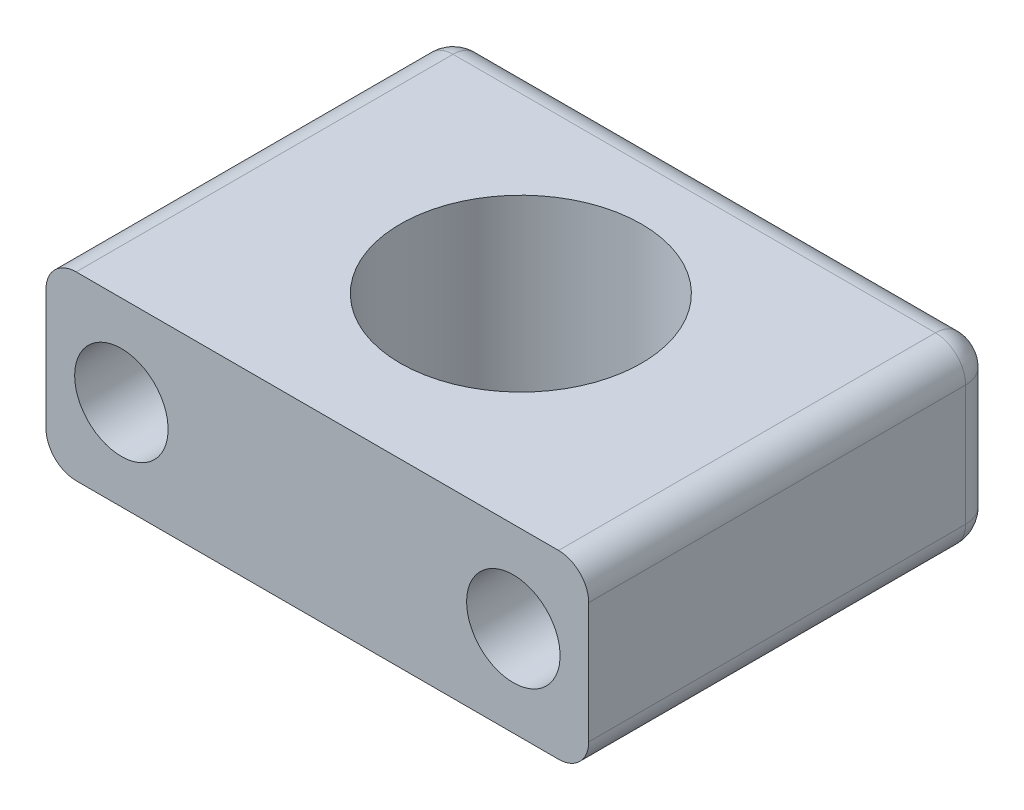
from build123d import *

# Parameters (mm, degrees)
SKETCH1_W           = 36
SKETCH1_H           = 27
SKETCH1_R           = 8
BOSS_EXTRUDE1_DEPTH = 12
SKETCH3_R           = 3.1
CUT_EXTRUDE1_DEPTH  = 35.597687784
FILLET1_R           = 2


with BuildPart() as part:
    # Sketch1 → Boss-Extrude1 (new body)
    with BuildSketch(Plane(origin=(0, 0, 0), x_dir=(1, 0, 0), z_dir=(0, 1, 0))):
        with Locations((0, 13.5)):
            Rectangle(SKETCH1_W, SKETCH1_H)
        with Locations(Location((0, 13.5, 0), (0, 0, 270))):
            Circle(SKETCH1_R, mode=Mode.SUBTRACT)
    extrude(amount=BOSS_EXTRUDE1_DEPTH)

    # Sketch3 → Cut-Extrude1 (cut, through all)
    with BuildSketch(Plane(origin=(0, 0, -27), x_dir=(-1, 0, 0), z_dir=(0, 0, -1))):
        with Locations((13, 6)):
            Circle(SKETCH3_R)
        with Locations((-13, 6)):
            Circle(SKETCH3_R)
    extrude(amount=-CUT_EXTRUDE1_DEPTH, mode=Mode.SUBTRACT)

    # Fillet1
    # the kernel refuses this fillet: 2 mm, written as the material it takes off along each edge
    with BuildSketch(Plane(origin=(16, 10, -25), x_dir=(1, 0, 0), z_dir=(0, 1, 0))) as fillet1_piece_1_section:
        Polygon((0, 0), (FILLET1_R, 0), (FILLET1_R, FILLET1_R), (0, FILLET1_R), align=None)
    fillet1_piece_1 = extrude(amount=FILLET1_R, mode=Mode.PRIVATE)
    fillet1_piece_1 = fillet1_piece_1 - Plane(origin=(16, 10, -25), x_dir=(-0.7071067811865476, 0, 0.7071067811865475), z_dir=(0, 1, 0)) * Sphere(FILLET1_R, mode=Mode.PRIVATE)
    add(fillet1_piece_1, mode=Mode.SUBTRACT)
    with BuildSketch(Plane(origin=(-16, 10, -25), x_dir=(0, 1, 0), z_dir=(-1, 0, 0))) as fillet1_piece_2_section:
        Polygon((0, 0), (FILLET1_R, 0), (FILLET1_R, FILLET1_R), (0, FILLET1_R), align=None)
    fillet1_piece_2 = extrude(amount=FILLET1_R, mode=Mode.PRIVATE)
    fillet1_piece_2 = fillet1_piece_2 - Plane(origin=(-16, 10, -25), x_dir=(0, -0.7071067811865475, 0.7071067811865475), z_dir=(-1, 0, 0)) * Sphere(FILLET1_R, mode=Mode.PRIVATE)
    add(fillet1_piece_2, mode=Mode.SUBTRACT)
    with BuildSketch(Plane(origin=(16, 2, -25), x_dir=(1, 0, 0), z_dir=(0, -1, 0))) as fillet1_piece_3_section:
        Polygon((0, 0), (FILLET1_R, 0), (FILLET1_R, -FILLET1_R), (0, -FILLET1_R), align=None)
    fillet1_piece_3 = extrude(amount=FILLET1_R, mode=Mode.PRIVATE)
    fillet1_piece_3 = fillet1_piece_3 - Plane(origin=(16, 2, -25), x_dir=(-0.7071067811865476, 0, 0.7071067811865475), z_dir=(0, -1, 0)) * Sphere(FILLET1_R, mode=Mode.PRIVATE)
    add(fillet1_piece_3, mode=Mode.SUBTRACT)
    with BuildSketch(Plane(origin=(-16, 2, -25), x_dir=(0, -1, 0), z_dir=(-1, 0, 0))) as fillet1_piece_4_section:
        Polygon((0, 0), (FILLET1_R, 0), (FILLET1_R, -FILLET1_R), (0, -FILLET1_R), align=None)
    fillet1_piece_4 = extrude(amount=FILLET1_R, mode=Mode.PRIVATE)
    fillet1_piece_4 = fillet1_piece_4 - Plane(origin=(-16, 2, -25), x_dir=(0, 0.7071067811865475, 0.7071067811865475), z_dir=(-1, 0, 0)) * Sphere(FILLET1_R, mode=Mode.PRIVATE)
    add(fillet1_piece_4, mode=Mode.SUBTRACT)
    with BuildSketch(Plane(origin=(18, 12, 5), x_dir=(-1, 0, 0), z_dir=(0, 0, -1)), Plane(origin=(-18, 0, -25), x_dir=(0, 1, 0), z_dir=(0, 0, 1))) as fillet1_piece_5:
        with BuildLine():
            CenterArc((FILLET1_R, -FILLET1_R), FILLET1_R, 90, 90)
            Line((0, -FILLET1_R), (0, 0))
            Line((0, 0), (FILLET1_R, 0))
        make_face()
    extrude(amount=30, mode=Mode.SUBTRACT)
    with BuildSketch(Plane(origin=(16, 12, -27), x_dir=(0, 0, 1), z_dir=(-1, 0, 0))) as fillet1_piece_6:
        with BuildLine():
            CenterArc((FILLET1_R, -FILLET1_R), FILLET1_R, 90, 90)
            Line((0, -FILLET1_R), (0, 0))
            Line((0, 0), (FILLET1_R, 0))
        make_face()
    extrude(amount=32, mode=Mode.SUBTRACT)
    with BuildSketch(Plane(origin=(-18, 12, -25), x_dir=(0, -1, 0), z_dir=(0, 0, 1)), Plane(origin=(18, 0, 5), x_dir=(-1, 0, 0), z_dir=(0, 0, -1))) as fillet1_piece_7:
        with BuildLine():
            CenterArc((FILLET1_R, FILLET1_R), FILLET1_R, 180, 90)
            Line((0, FILLET1_R), (0, 0))
            Line((0, 0), (FILLET1_R, 0))
        make_face()
    extrude(amount=30, mode=Mode.SUBTRACT)
    with BuildSketch(Plane(origin=(16, 0, -27), x_dir=(0, 0, 1), z_dir=(-1, 0, 0))) as fillet1_piece_8:
        with BuildLine():
            CenterArc((FILLET1_R, FILLET1_R), FILLET1_R, 180, 90)
            Line((0, FILLET1_R), (0, 0))
            Line((0, 0), (FILLET1_R, 0))
        make_face()
    extrude(amount=32, mode=Mode.SUBTRACT)
    with BuildSketch(Plane(origin=(-18, 2, -27), x_dir=(0, 0, 1), z_dir=(0, 1, 0))) as fillet1_piece_9:
        with BuildLine():
            CenterArc((FILLET1_R, FILLET1_R), FILLET1_R, 180, 90)
            Line((0, FILLET1_R), (0, 0))
            Line((0, 0), (FILLET1_R, 0))
        make_face()
    extrude(amount=8, mode=Mode.SUBTRACT)
    with BuildSketch(Plane(origin=(18, 2, -27), x_dir=(0, 0, 1), z_dir=(0, 1, 0))) as fillet1_piece_10:
        with BuildLine():
            CenterArc((FILLET1_R, -FILLET1_R), FILLET1_R, 90, 90)
            Line((0, -FILLET1_R), (0, 0))
            Line((0, 0), (FILLET1_R, 0))
        make_face()
    extrude(amount=8, mode=Mode.SUBTRACT)


solid = part.part
